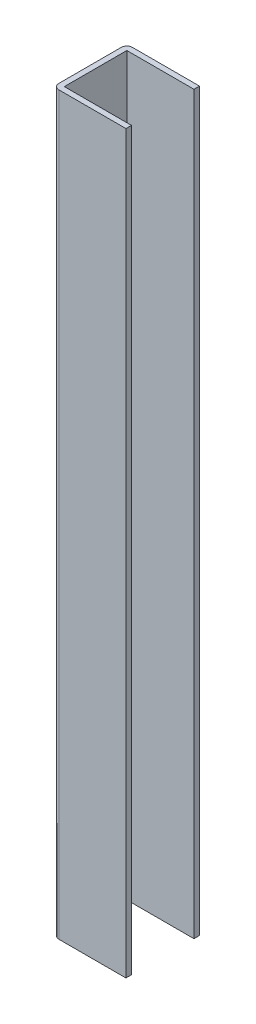
from build123d import *

# Parameters (mm, degrees)
SKETCH_1_W          = 74
SKETCH_1_H          = 34
EXTRUDE_1_DEPTH     = 400
SKETCH_2_W          = 41.646480438
SKETCH_2_H          = 42.526894273
CUT_EXTRUDE_1_DEPTH = 403.49223595


with BuildPart() as part:
    # Эскиз1 → Вытянуть-Тонкостенный1 (new body)
    with BuildSketch(Plane(origin=(0, 0, 0), x_dir=(1, 0, 0), z_dir=(0, 1, 0))):
        with BuildLine():
            Line((40, 17), (40, -17))
            ThreePointArc((40, -17), (39.121320344, -19.121320344), (37, -20))
            Line((37, -20), (-37, -20))
            ThreePointArc((-37, -20), (-39.121320344, -19.121320344), (-40, -17))
            Line((-40, -17), (-40, 17))
            ThreePointArc((-40, 17), (-39.121320344, 19.121320344), (-37, 20))
            Line((-37, 20), (37, 20))
            ThreePointArc((37, 20), (39.121320344, 19.121320344), (40, 17))
        make_face()
        Rectangle(SKETCH_1_W, SKETCH_1_H, mode=Mode.SUBTRACT)
    extrude(amount=EXTRUDE_1_DEPTH)

    # Эскиз2 → Вырез-Вытянуть1 (cut, through all)
    with BuildSketch(Plane(origin=(0, 400, 0), x_dir=(1, 0, 0), z_dir=(0, 1, 0))):
        with Locations((20.323240219, -0.290673418)):
            Rectangle(SKETCH_2_W, SKETCH_2_H)
    extrude(amount=-CUT_EXTRUDE_1_DEPTH, mode=Mode.SUBTRACT)


solid = part.part
